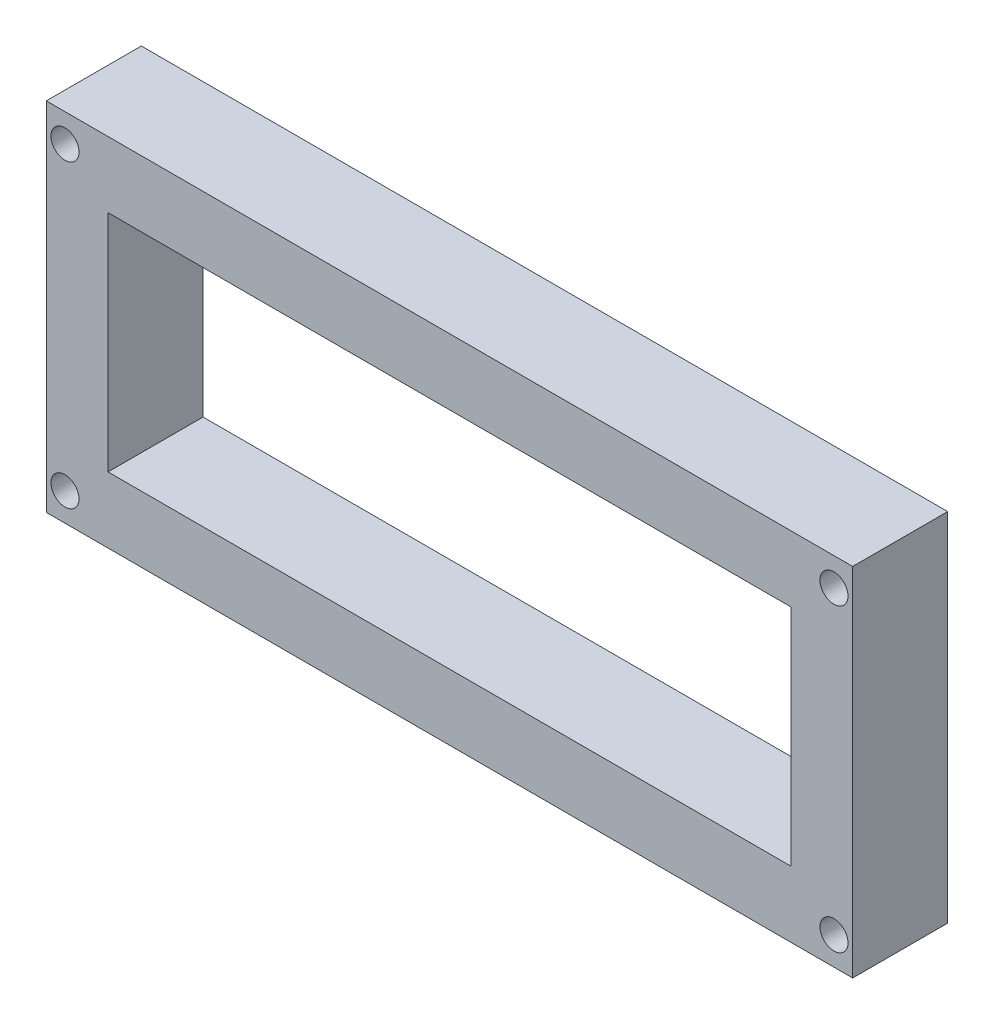
from build123d import *

# Parameters (mm, degrees)
SKETCH1_W           = 86.199999926
SKETCH1_H           = 38.1
SKETCH1_W_2         = 73
SKETCH1_H_2         = 24
BOSS_EXTRUDE1_DEPTH = 10.16
SKETCH2_R           = 1.5
CUT_EXTRUDE1_DEPTH  = 10.16


with BuildPart() as part:
    # Sketch1 → Boss-Extrude1 (new body)
    with BuildSketch(Plane.XY):
        Rectangle(SKETCH1_W, SKETCH1_H)
        Rectangle(SKETCH1_W_2, SKETCH1_H_2, mode=Mode.SUBTRACT)
    extrude(amount=BOSS_EXTRUDE1_DEPTH)

    # Sketch2 → Cut-Extrude1 (cut)
    with BuildSketch(Plane.XY.offset(10.16)):
        with Locations((41.099999963, 16.05)):
            Circle(SKETCH2_R)
        with Locations((-41.099999963, 16.05)):
            Circle(SKETCH2_R)
        with Locations((-41.099999963, -16.05)):
            Circle(SKETCH2_R)
        with Locations((41.099999963, -16.05)):
            Circle(SKETCH2_R)
    extrude(amount=-CUT_EXTRUDE1_DEPTH, mode=Mode.SUBTRACT)


solid = part.part
